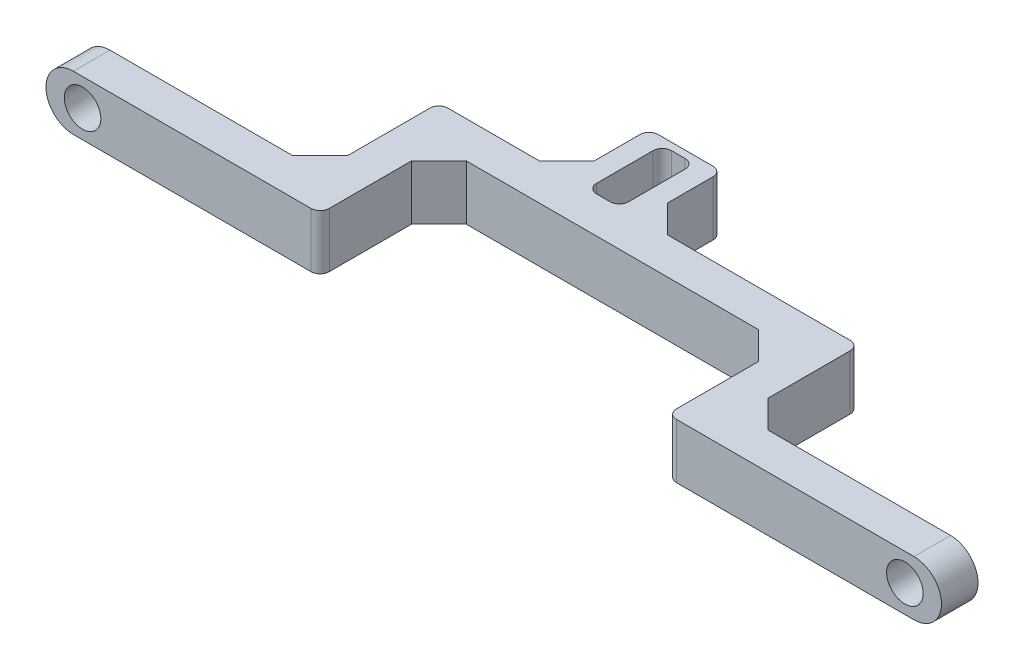
from build123d import *

# Parameters (mm, degrees)
CROQUIS1_R                = 3
SALIENTE_EXTRUIR1_DEPTH   = 4
SALIENTE_EXTRUIR1_2_DEPTH = 4
CROQUIS2_W                = 90
CROQUIS2_H                = 6
SALIENTE_EXTRUIR2_DEPTH   = 4
CROQUIS4_W                = 46
CROQUIS4_H                = 13
SALIENTE_EXTRUIR3_DEPTH   = 6
CROQUIS5_W                = 38
CROQUIS5_H                = 13
CORTAR_EXTRUIR1_DEPTH     = 95.09569597
CROQUIS6_W                = 8
CROQUIS6_H                = 9
SALIENTE_EXTRUIR4_DEPTH   = 3
CROQUIS7_W                = 3.5
CROQUIS7_H                = 8.2
CORTAR_EXTRUIR2_DEPTH     = 96.754895436
CHAFL_N1_SIZE             = 3
REDONDEO1_R               = 1
CROQUIS8_R                = 1.75
CORTAR_EXTRUIR3_DEPTH     = 97.612628574
SALIENTE_EXTRUIR5_DEPTH   = 4
CROQUIS10_R               = 2
CORTAR_EXTRUIR4_DEPTH     = 97.586748573


with BuildPart() as part:
    # Croquis1 → Saliente-Extruir1 (new body)
    with BuildSketch(Plane.XY):
        Circle(CROQUIS1_R)
    extrude(amount=SALIENTE_EXTRUIR1_DEPTH)



with BuildPart() as body_2:
    # Croquis1 → Saliente-Extruir1 2 (new body)
    with BuildSketch(Plane.XY):
        with Locations((90, 0)):
            Circle(CROQUIS1_R)
    extrude(amount=SALIENTE_EXTRUIR1_2_DEPTH)


with BuildPart() as part_1:
    add(part.part)

    add(body_2.part)  # Saliente-Extruir2 merges body 2
    # Croquis2 → Saliente-Extruir2 (add)
    with BuildSketch(Plane.XY):
        with Locations((45, 0)):
            Rectangle(CROQUIS2_W, CROQUIS2_H)
    extrude(amount=SALIENTE_EXTRUIR2_DEPTH)

    # Croquis4 → Saliente-Extruir3 (add)
    with BuildSketch(Plane(origin=(0, 3, 0), x_dir=(1, 0, 0), z_dir=(0, 1, 0))):
        with Locations((45, 6.5)):
            Rectangle(CROQUIS4_W, CROQUIS4_H)
    extrude(amount=-SALIENTE_EXTRUIR3_DEPTH)

    # Croquis5 → Cortar-Extruir1 (cut, through all)
    with BuildSketch(Plane(origin=(0, 3, 0), x_dir=(1, 0, 0), z_dir=(0, 1, 0))):
        with Locations((45, 2.5)):
            Rectangle(CROQUIS5_W, CROQUIS5_H)
    extrude(amount=-CORTAR_EXTRUIR1_DEPTH, mode=Mode.SUBTRACT)

    # Croquis6 → Saliente-Extruir4 (add, symmetric)
    with BuildSketch(Plane(origin=(0, 0, 0), x_dir=(1, 0, 0), z_dir=(0, 1, 0))):
        with Locations((40, 17.5)):
            Rectangle(CROQUIS6_W, CROQUIS6_H)
    extrude(amount=SALIENTE_EXTRUIR4_DEPTH, both=True)

    # Croquis7 → Cortar-Extruir2 (cut, through all)
    with BuildSketch(Plane(origin=(0, 3, 0), x_dir=(1, 0, 0), z_dir=(0, 1, 0))):
        with Locations((40, 17.1)):
            Rectangle(CROQUIS7_W, CROQUIS7_H)
    extrude(amount=-CORTAR_EXTRUIR2_DEPTH, mode=Mode.SUBTRACT)

    # Chaflán1
    chafl_n1_edges = [part_1.edges().sort_by_distance(p)[0] for p in [
        (68, 0, 0),
        (22, 0, 0),
        (26, 0, -9),
        (64, 0, -9),
        (36, 0, -13),
        (44, 0, -13),
    ]]
    chamfer(chafl_n1_edges, length=CHAFL_N1_SIZE)

    # Redondeo1
    redondeo1_edges = [part_1.edges().sort_by_distance(p)[0] for p in [
        (41.75, 0, -13),
        (38.25, 0, -13),
        (38.25, 0, -21.2),
        (41.75, 0, -21.2),
        (68, 0, -13),
        (64, 0, 4),
        (26, 0, 4),
        (22, 0, -13),
        (36, 0, -22),
        (44, 0, -22),
    ]]
    fillet(redondeo1_edges, radius=REDONDEO1_R)

    # Croquis8 → Cortar-Extruir3 (cut, through all)
    with BuildSketch(Plane.XY.offset(4)):
        Circle(CROQUIS8_R)
        with Locations((90, 0)):
            Circle(CROQUIS8_R)
    extrude(amount=-CORTAR_EXTRUIR3_DEPTH, mode=Mode.SUBTRACT)

    # Croquis9 → Saliente-Extruir5 (add)
    with BuildSketch(Plane.XY.offset(4)):
        with BuildLine():
            Line((-1, 3), (0, 3))
            Line((0, 3), (0, 2.5))
            ThreePointArc((0, 2.5), (-2.5, 0), (0, -2.5))
            Line((0, -2.5), (0, -3))
            Line((0, -3), (-1, -3))
            ThreePointArc((-1, -3), (-4, 0), (-1, 3))
        make_face()
    saliente_extruir5 = extrude(amount=-SALIENTE_EXTRUIR5_DEPTH)

    # Simetría1: Saliente-Extruir5 across plane
    add(saliente_extruir5.mirror(Plane(origin=(45, 0, 0), x_dir=(0, 0, 1), z_dir=(1, 0, 0))))

    # Croquis10 → Cortar-Extruir4 (cut, through all)
    with BuildSketch(Plane(origin=(0, 0, 0), x_dir=(-1, 0, 0), z_dir=(0, 0, -1))):
        Circle(CROQUIS10_R)
        with Locations((-90, 0)):
            Circle(CROQUIS10_R)
    extrude(amount=-CORTAR_EXTRUIR4_DEPTH, mode=Mode.SUBTRACT)


solid = part_1.part
